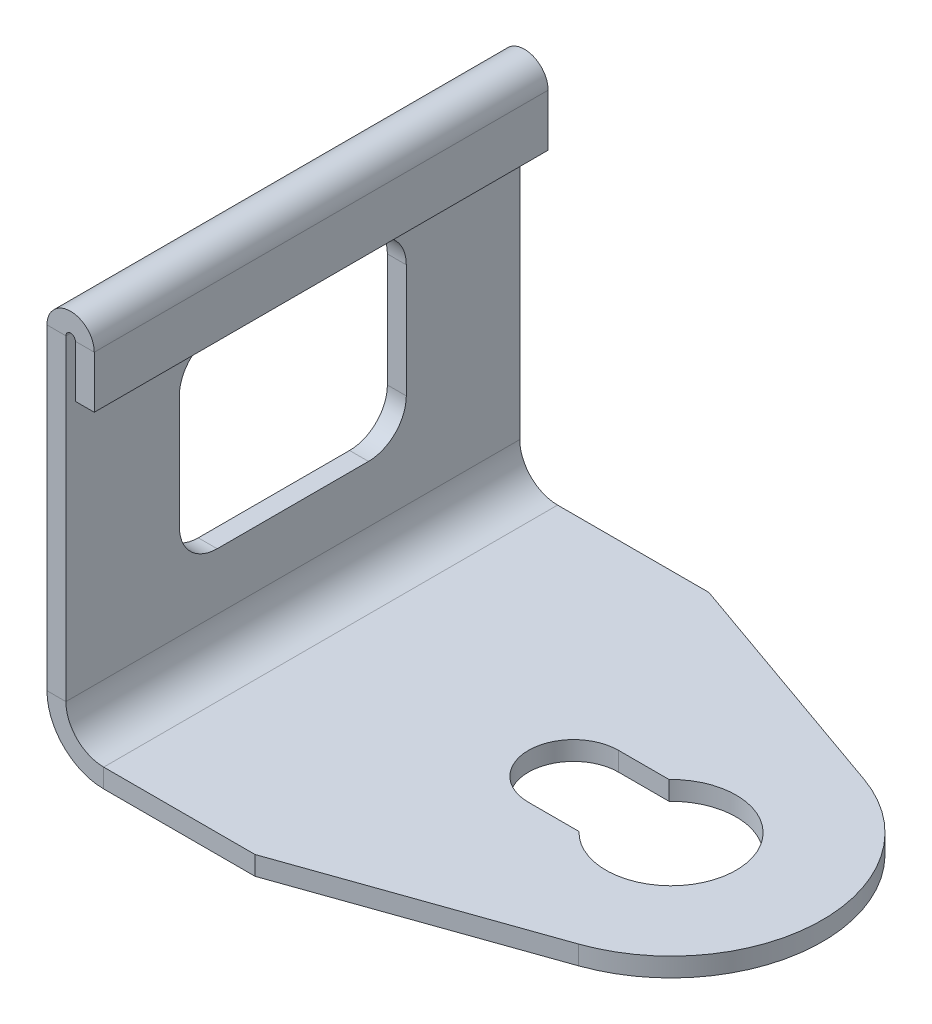
from build123d import *

# Parameters (mm, degrees)
BASE_FLANGE1_DEPTH           = 1
EDGE_FLANGE1_STRIP_W         = 8
EDGE_FLANGE1_STRIP_H         = 1
EDGE_FLANGE1_STRIP_CUT_DEPTH = 24
EDGE_FLANGE1_DEPTH           = 24
HEM1_START                   = -12
HEM1_DEPTH                   = 24
HEM1_2_DEPTH                 = 24
CUT_EXTRUDE1_DEPTH           = 10


# Read off the part's stored shape, not the designer's step: Hem1
# Sheet-metal steps are written as plain solids
with BuildPart() as part:
    # Sketch1 → Base-Flange1 (new body)
    with BuildSketch(Plane(origin=(0, 0, 0), x_dir=(1, 0, 0), z_dir=(0, 1, 0))):
        with BuildLine():
            Line((-5.5, 12), (5.5, 12))
            Line((5.5, 12), (18.155635881, 7.546363234))
            ThreePointArc((18.155635881, 7.546363234), (23.5, 0), (18.155635881, -7.546363234))
            Line((18.155635881, -7.546363234), (5.5, -12))
            Line((5.5, -12), (-5.5, -12))
            Line((-5.5, -12), (-5.5, 12))
        make_face()
        with BuildLine():
            Line((10.34, 2.38), (13.012470906, 2.38))
            ThreePointArc((13.012470906, 2.38), (18.942702571, 0), (13.012470906, -2.38))
            Line((13.012470906, -2.38), (10.34, -2.38))
            ThreePointArc((10.34, -2.38), (7.96, 0), (10.34, 2.38))
        make_face(mode=Mode.SUBTRACT)
    extrude(amount=BASE_FLANGE1_DEPTH)

    # Edge-Flange1 strip (across the edge) → Edge-Flange1 strip cut (cut)
    with BuildSketch(Plane(origin=(-5.5, 1, -12), x_dir=(1, 0, 0), z_dir=(0, 0, 1))):
        with Locations((-1, -0.5)):
            Rectangle(EDGE_FLANGE1_STRIP_W, EDGE_FLANGE1_STRIP_H)
    extrude(amount=EDGE_FLANGE1_STRIP_CUT_DEPTH, mode=Mode.SUBTRACT)

    # Edge-Flange1 section (across the edge) → Edge-Flange1 (add)
    with BuildSketch(Plane(origin=(-5.5, 1, -12), x_dir=(1, 0, 0), z_dir=(0, 0, 1))):
        with BuildLine():
            Line((0, 2), (0, 20))
            Line((0, 20), (1, 20))
            Line((1, 20), (1, 2))
            ThreePointArc((1, 2), (1.585786438, 0.585786438), (3, 0))
            Line((3, 0), (3, -1))
            ThreePointArc((3, -1), (0.878679656, -0.121320344), (0, 2))
        make_face()
    extrude(amount=EDGE_FLANGE1_DEPTH)

    # Hem1 outline → Hem1 (cut)
    with BuildSketch(Plane.XY.offset(HEM1_START)):
        with BuildLine():
            ThreePointArc((-5.5, 19.75), (-5.218245837, 20.540569415), (-4.5, 20.974744871))
            Line((-4.5, 20.974744871), (-4.5, 21))
            Line((-4.5, 21), (-5.5, 21))
            Line((-5.5, 21), (-5.5, 19.75))
        make_face()
    extrude(amount=HEM1_DEPTH, mode=Mode.SUBTRACT)

    # Hem1 2 outline → Hem1 2 (add)
    with BuildSketch(Plane.XY.offset(HEM1_START)):
        with BuildLine():
            Line((-4, 17), (-3, 17))
            Line((-3, 17), (-3, 19.75))
            ThreePointArc((-3, 19.75), (-3.459430585, 20.718245837), (-4.5, 20.974744871))
            Line((-4.5, 20.974744871), (-4.5, 19.75))
            ThreePointArc((-4.5, 19.75), (-4.25, 20), (-4, 19.75))
            Line((-4, 19.75), (-4, 17))
        make_face()
    extrude(amount=HEM1_2_DEPTH)

    # Sketch11 → Cut-Extrude1 (cut)
    with BuildSketch(Plane(origin=(-4.5, 0, 0), x_dir=(0, 0, -1), z_dir=(1, 0, 0))):
        with BuildLine():
            Line((-4, 16), (4, 16))
            ThreePointArc((4, 16), (5.414213562, 15.414213562), (6, 14))
            Line((6, 14), (6, 8))
            ThreePointArc((6, 8), (5.414213562, 6.585786438), (4, 6))
            Line((4, 6), (-4, 6))
            ThreePointArc((-4, 6), (-5.414213562, 6.585786438), (-6, 8))
            Line((-6, 8), (-6, 14))
            ThreePointArc((-6, 14), (-5.414213562, 15.414213562), (-4, 16))
        make_face()
    extrude(amount=-CUT_EXTRUDE1_DEPTH, mode=Mode.SUBTRACT)


solid = part.part
